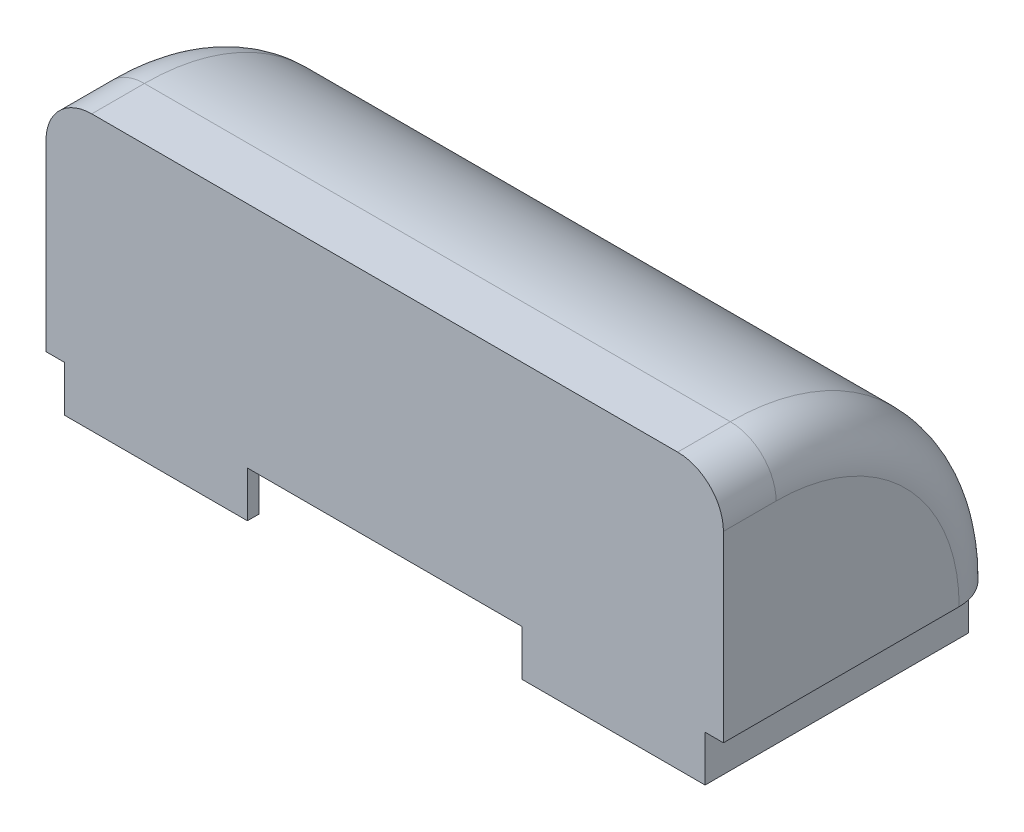
from build123d import *

# Parameters (mm, degrees)
BOSS_EXTRUDE1_DEPTH = 2
BOSS_EXTRUDE2_DEPTH = 10
CUT_EXTRUDE1_REACH  = 34.605
FILLET1_R           = 2
CHAMFER1_SIZE       = 2


with BuildPart() as part:
    # Sketch1 → Boss-Extrude1 (new body)
    with BuildSketch(Plane(origin=(0, 0, 0), x_dir=(1, 0, 0), z_dir=(0, 1, 0))):
        Polygon((14, 5.75), (-14, 5.75), (-14, -5.75), (-6, -5.75), (-6, -5.25), (-13.5, -5.25), (-13.5, 5.25), (13.5, 5.25), (13.5, -5.25), (6, -5.25), (6, -5.75), (14, -5.75), align=None)
    extrude(amount=BOSS_EXTRUDE1_DEPTH)

    # Sketch2 → Boss-Extrude2 (add)
    with BuildSketch(Plane(origin=(0, 2, 0), x_dir=(1, 0, 0), z_dir=(0, 1, 0))):
        Polygon((-14.8, 6.55), (-14.8, -5.75), (-14, -5.75), (-14, 5.75), (14, 5.75), (14, -5.75), (14.8, -5.75), (14.8, 6.55), align=None)
        Polygon((-14, 5.75), (-14, -5.75), (-6, -5.75), (-6, -5.25), (-13.5, -5.25), (-13.5, 5.25), (13.5, 5.25), (13.5, -5.25), (6, -5.25), (6, -5.75), (14, -5.75), (14, 5.75), align=None)
        Polygon((-6, -5.75), (-5.2, -5.75), (-5.2, -4.45), (-12.7, -4.45), (-12.7, 4.45), (12.7, 4.45), (12.7, -4.45), (5.2, -4.45), (5.2, -5.75), (6, -5.75), (6, -5.25), (13.5, -5.25), (13.5, 5.25), (-13.5, 5.25), (-13.5, -5.25), (-6, -5.25), align=None)
        Polygon((-5.2, -4.45), (-5.2, -5.75), (5.2, -5.75), (5.2, -4.45), (12.7, -4.45), (12.7, 4.45), (-12.7, 4.45), (-12.7, -4.45), align=None)
    extrude(amount=BOSS_EXTRUDE2_DEPTH)

    # Sketch3 → Cut-Extrude1 (cut, up to next)
    with BuildSketch(Plane(origin=(14.8, 0, 0), x_dir=(0, 0, -1), z_dir=(1, 0, 0)), mode=Mode.PRIVATE) as cut_extrude1_sk1:
        with BuildLine():
            Line((6.55, 12), (-3.45, 12))
            ThreePointArc((-3.45, 12), (3.621067812, 9.071067812), (6.55, 2))
            Line((6.55, 2), (6.55, 12))
        make_face()
    cut_extrude1_tool1 = extrude(cut_extrude1_sk1.sketch, amount=-CUT_EXTRUDE1_REACH, mode=Mode.PRIVATE) & part.part
    add(cut_extrude1_tool1.solids().sort_by_distance((14.8, 9.766321, -4.316321))[0], mode=Mode.SUBTRACT)

    # Fillet1
    fillet1_edges = [part.edges().sort_by_distance(p)[0] for p in [
        (14.8, 12, 4.6),
        (-14.8, 12, 4.6),
        (14.8, 9.071067812, -3.621067812),
        (-14.8, 9.071067812, -3.621067812),
    ]]
    fillet(fillet1_edges, radius=FILLET1_R)

    # Chamfer1
    chamfer1_edges = [part.edges().sort_by_distance(p)[0] for p in [
        (0, 2, -5.25),
    ]]
    chamfer(chamfer1_edges, length=CHAMFER1_SIZE - 0.0001)  # a hair under: the kernel refuses the full size


solid = part.part
